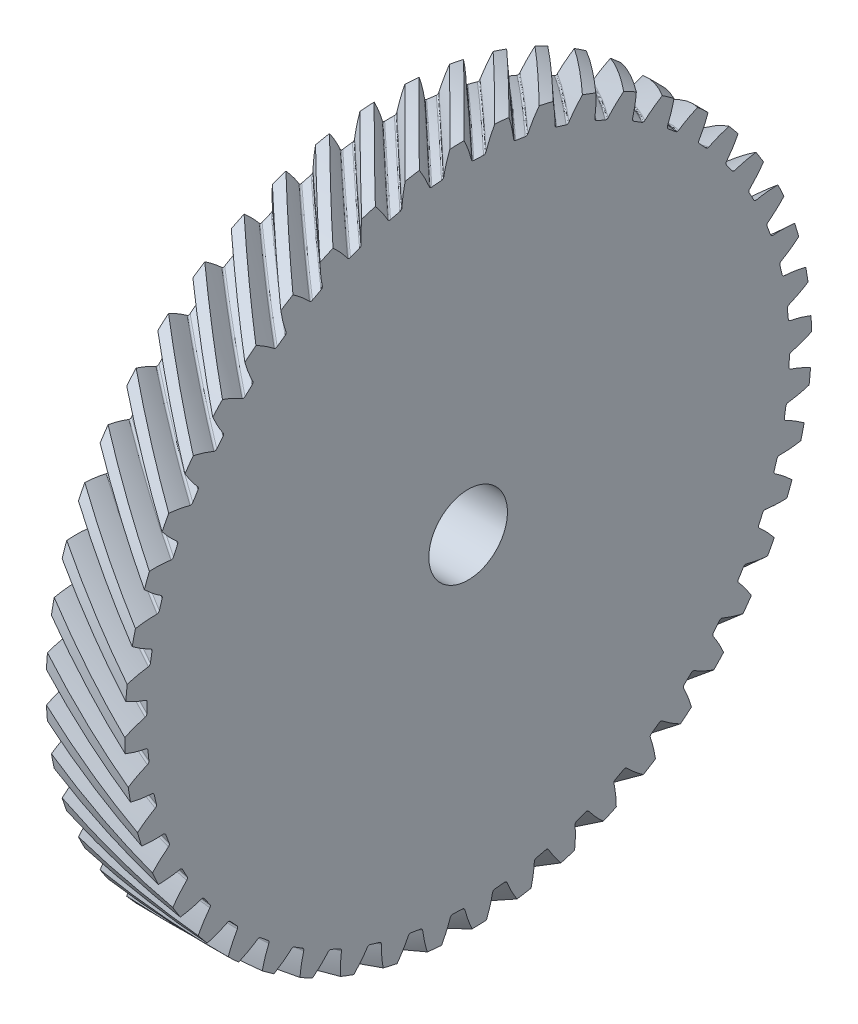
from build123d import *

# Parameters (mm, degrees)
BASPROSKE_W            = 12.7
BASPROSKE_H            = 55.469036726
TOOTHCUTRH_PITCH       = 348.522236563
TOOTHCUTRH_HEIGHT      = 12.7
TOOTHCUTRH_RADIUS      = 55.469036726
TOOTHCUTRH_START_ANGLE = -90
TEETHCUTSRH_COUNT      = 48
TEETHCUTSRH_ANGLE      = 352.5
BORSKE_R               = 6.35
BORE_DEPTH             = 50.8000508


with BuildPart() as part:
    # BasProSke → Base-Revolve (revolve)
    with BuildSketch(Plane(origin=(0, 0, 0), x_dir=(1, 0, 0), z_dir=(0, 1, 0)), mode=Mode.PRIVATE) as base_revolve_sk:
        with Locations((6.35, 27.734518363)):
            Rectangle(BASPROSKE_W, BASPROSKE_H)
    revolve(base_revolve_sk.sketch.rotate(Axis((-10, 0, 0), (1, 0, 0)), 180), axis=Axis((-10, 0, 0), (1, 0, 0)))

    # ToothCutRH: sweep along a helix
    with BuildLine() as toothcutrh_path:
        add(Helix(TOOTHCUTRH_PITCH, TOOTHCUTRH_HEIGHT, TOOTHCUTRH_RADIUS, center=(0, 0, 0), direction=(1, 0, 0), mode=Mode.PRIVATE).rotate(Axis((0, 0, 0), (1, 0, 0)), TOOTHCUTRH_START_ANGLE))
    # TooCutSkeRH → ToothCutRH (sweep, cut)
    with BuildSketch(Plane(origin=(0, 0, 0), x_dir=(0, 0, -1), z_dir=(1, 0, 0))):
        with BuildLine():
            ThreePointArc((0.787724265, 51.891183121), (0, 51.897161726), (-0.787724265, 51.891183121))
            ThreePointArc((-0.787724265, 51.891183121), (-1.029207206, 51.968209675), (-1.175267679, 52.175365266))
            ThreePointArc((-1.175267679, 52.175365266), (-2.120356221, 54.68205803), (-3.407734988, 57.031389185))
            ThreePointArc((-3.407734988, 57.031389185), (0, 57.133107828), (3.407734988, 57.031389185))
            ThreePointArc((3.407734988, 57.031389185), (2.120356221, 54.68205803), (1.175267679, 52.175365266))
            ThreePointArc((1.175267679, 52.175365266), (1.029207206, 51.968209675), (0.787724265, 51.891183121))
        make_face()
    toothcutrh = sweep(path=toothcutrh_path.line, is_frenet=True, mode=Mode.SUBTRACT)

    # TeethCutsRH: ToothCutRH ×48 about axis
    teethcutsrh_axis = Axis((-10, 0, 0), (1, 0, 0))
    for i in range(1, TEETHCUTSRH_COUNT):
        add(toothcutrh.rotate(teethcutsrh_axis, i * TEETHCUTSRH_ANGLE / (TEETHCUTSRH_COUNT - 1)), mode=Mode.SUBTRACT)

    # BorSke → Bore (cut, symmetric)
    with BuildSketch(Plane(origin=(0, 0, 0), x_dir=(0, 0, -1), z_dir=(1, 0, 0))):
        with Locations(Location((0, 0, 0), (0, 0, 180))):
            Circle(BORSKE_R)
    extrude(amount=BORE_DEPTH, both=True, mode=Mode.SUBTRACT)


solid = part.part
